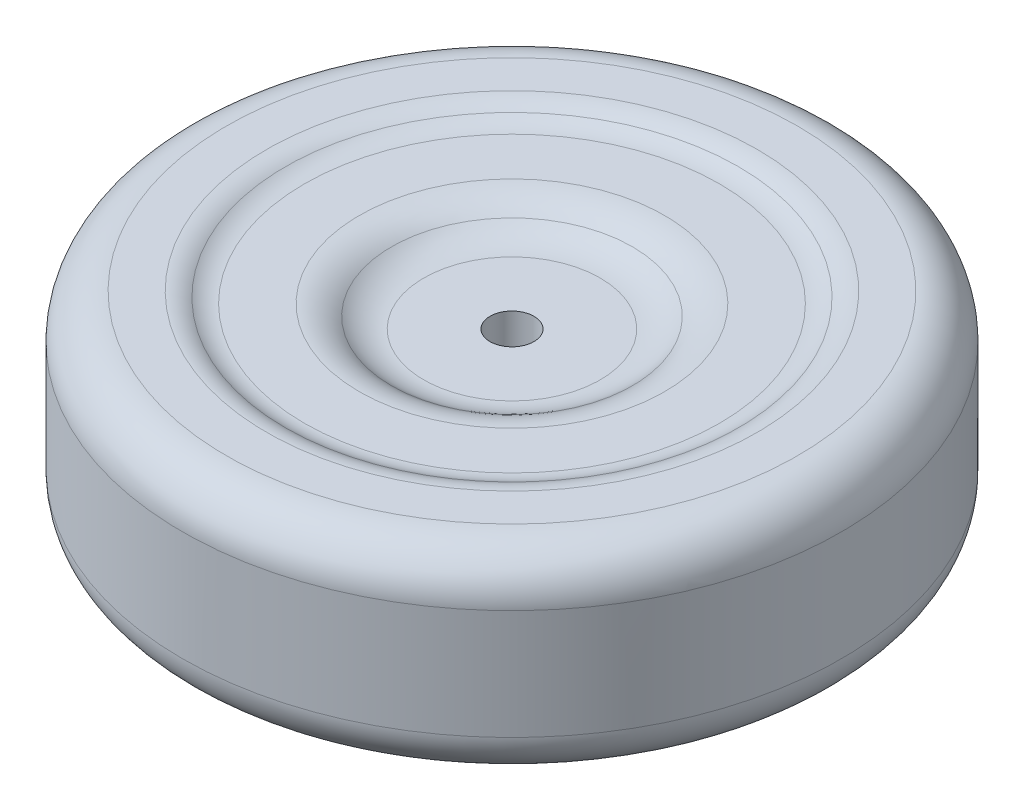
from build123d import *

# Parameters (mm, degrees)
SKETCH1_R            = 190.5
BOSS_EXTRUDE1_DEPTH  = 57.15
SKETCH2_R            = 19.05
CUT_EXTRUDE1_DEPTH   = 484.378
SKETCH3_R            = 127
CUT_EXTRUDE2_DEPTH   = 6.35
SKETCH4_R            = 63.5
CUT_EXTRUDE3_DEPTH   = 19.05
FILLET1_R            = 20.32
FILLET2_R            = 20.32
FILLET3_R            = 30.48
FILLET4_R            = 30.48
FILLET1_OF_MIRROR2_R = 20.32
FILLET2_OF_MIRROR2_R = 20.32
FILLET3_OF_MIRROR2_R = 30.48
FILLET4_OF_MIRROR2_R = 30.48
FILLET7_R            = 25.4
FILLET8_R            = 25.4
SKETCH5_R            = 51.013146757
BOSS_EXTRUDE3_DEPTH  = 76.2
SKETCH6_R            = 12.7
CUT_EXTRUDE4_DEPTH   = 1040.638


with BuildPart() as part:
    # Sketch1 → Boss-Extrude1 (new body)
    with BuildSketch(Plane(origin=(0, 0, 0), x_dir=(1, 0, 0), z_dir=(0, 1, 0))):
        with Locations(Location((0, 0, 0), (0, 0, 270))):
            Circle(SKETCH1_R)
    boss_extrude1 = extrude(amount=BOSS_EXTRUDE1_DEPTH)

    # Sketch2 → Cut-Extrude1 (cut)
    with BuildSketch(Plane(origin=(0, 57.15, 0), x_dir=(1, 0, 0), z_dir=(0, 1, 0))):
        with Locations(Location((0, 0, 0), (0, 0, 270))):
            Circle(SKETCH2_R)
    cut_extrude1 = extrude(amount=-CUT_EXTRUDE1_DEPTH, mode=Mode.SUBTRACT)

    # Sketch3 → Cut-Extrude2 (cut)
    with BuildSketch(Plane(origin=(0, 0, 0), x_dir=(-1, 0, 0), z_dir=(0, -1, 0))):
        with Locations(Location((0, 0, 0), (0, 0, 90))):
            Circle(SKETCH3_R)
    cut_extrude2 = extrude(amount=-CUT_EXTRUDE2_DEPTH, mode=Mode.SUBTRACT)

    # Sketch4 → Cut-Extrude3 (cut)
    with BuildSketch(Plane(origin=(0, 0, 0), x_dir=(1, 0, 0), z_dir=(0, 1, 0))):
        with Locations(Location((0, 0, 0), (0, 0, 90))):
            Circle(SKETCH4_R)
    cut_extrude3 = extrude(amount=CUT_EXTRUDE3_DEPTH, mode=Mode.SUBTRACT)

    # Fillet1
    # the kernel refuses this fillet: 20.32 mm, written as the material it takes off along each edge
    with BuildSketch(Plane(origin=(0, 0, 0), x_dir=(0, 0, -1), z_dir=(-1, 0, 0))) as fillet1_piece_1:
        with BuildLine():
            CenterArc((141.756066549, -20.32), FILLET1_R, 90, 46.567463442)
            Line((127, -6.35), (126.704878669, -6.0706))
            ThreePointArc((126.704878669, -6.0706), (126.5936, -3.175), (126.5936, 0))
            Line((126.5936, 0), (127, 0.4064))
            Line((127, 0.4064), (141.756066549, 0.4064))
            Line((141.756066549, 0.4064), (141.756066549, 0))
        make_face()
    revolve(axis=Axis((0, 0, 0), (0, -1, 0)), mode=Mode.SUBTRACT)

    # Fillet2
    fillet2_edges = [part.edges().sort_by_distance(p)[0] for p in [
        (0, 6.35, 127),
    ]]
    fillet(fillet2_edges, radius=FILLET2_R)

    # Fillet3
    # the kernel refuses this fillet: 30.48 mm, written as the material it takes off along each edge
    with BuildSketch(Plane(origin=(0, 6.35, 0), x_dir=(0, 0, -1), z_dir=(-1, 0, 0))) as fillet3_piece_1:
        with BuildLine():
            CenterArc((88.256857636, -30.48), FILLET3_R, 90, 54.314665287)
            Line((63.5, -12.7), (63.004862847, -12.3444))
            ThreePointArc((63.004862847, -12.3444), (62.8904, -6.35), (62.8904, 0))
            Line((62.8904, 0), (63.5, 0.6096))
            Line((63.5, 0.6096), (88.256857636, 0.6096))
            Line((88.256857636, 0.6096), (88.256857636, 0))
        make_face()
    revolve(axis=Axis((0, 6.35, 0), (0, -1, 0)), mode=Mode.SUBTRACT)

    # Fillet4
    fillet4_edges = [part.edges().sort_by_distance(p)[0] for p in [
        (0, 19.05, 63.5),
    ]]
    fillet(fillet4_edges, radius=FILLET4_R)

    # Mirror2: Boss-Extrude1, Cut-Extrude1, Cut-Extrude2, Cut-Extrude3 across plane
    add(boss_extrude1.mirror(Plane.ZX.offset(57.15)))
    add(cut_extrude1.mirror(Plane.ZX.offset(57.15)), mode=Mode.SUBTRACT)
    add(cut_extrude2.mirror(Plane.ZX.offset(57.15)), mode=Mode.SUBTRACT)
    add(cut_extrude3.mirror(Plane.ZX.offset(57.15)), mode=Mode.SUBTRACT)

    # Fillet1 of Mirror2
    # the kernel refuses this fillet: 20.32 mm, written as the material it takes off along each edge
    with BuildSketch(Plane(origin=(0, 114.3, 0), x_dir=(0, 0, -1), z_dir=(-1, 0, 0))) as fillet1_of_mirror2_piece_1:
        with BuildLine():
            CenterArc((141.756066549, 20.32), FILLET1_OF_MIRROR2_R, 223.432536558, 46.567463442)
            Line((127, 6.35), (126.704878669, 6.0706))
            ThreePointArc((126.704878669, 6.0706), (126.5936, 3.175), (126.5936, 0))
            Line((126.5936, 0), (127, -0.4064))
            Line((127, -0.4064), (141.756066549, -0.4064))
            Line((141.756066549, -0.4064), (141.756066549, 0))
        make_face()
    revolve(axis=Axis((0, 114.3, 0), (0, -1, 0)), mode=Mode.SUBTRACT)

    # Fillet2 of Mirror2
    fillet2_of_mirror2_edges = [part.edges().sort_by_distance(p)[0] for p in [
        (0, 107.95, 127),
    ]]
    fillet(fillet2_of_mirror2_edges, radius=FILLET2_OF_MIRROR2_R)

    # Fillet3 of Mirror2
    # the kernel refuses this fillet: 30.48 mm, written as the material it takes off along each edge
    with BuildSketch(Plane(origin=(0, 107.95, 0), x_dir=(0, 0, -1), z_dir=(1, 0, 0))) as fillet3_of_mirror2_piece_1:
        with BuildLine():
            CenterArc((88.256857636, -30.48), FILLET3_OF_MIRROR2_R, 90, 54.314665287)
            Line((63.5, -12.7), (63.004862847, -12.3444))
            ThreePointArc((63.004862847, -12.3444), (62.8904, -6.35), (62.8904, 0))
            Line((62.8904, 0), (63.5, 0.6096))
            Line((63.5, 0.6096), (88.256857636, 0.6096))
            Line((88.256857636, 0.6096), (88.256857636, 0))
        make_face()
    revolve(axis=Axis((0, 107.95, 0), (0, 1, 0)), mode=Mode.SUBTRACT)

    # Fillet4 of Mirror2
    fillet4_of_mirror2_edges = [part.edges().sort_by_distance(p)[0] for p in [
        (0, 95.25, 63.5),
    ]]
    fillet(fillet4_of_mirror2_edges, radius=FILLET4_OF_MIRROR2_R)

    # Fillet7
    fillet7_edges = [part.edges().sort_by_distance(p)[0] for p in [
        (0, 114.3, -190.5),
    ]]
    fillet(fillet7_edges, radius=FILLET7_R)

    # Fillet8
    fillet8_edges = [part.edges().sort_by_distance(p)[0] for p in [
        (0, 0, -190.5),
    ]]
    fillet(fillet8_edges, radius=FILLET8_R)

    # Sketch5 → Boss-Extrude3 (add)
    with BuildSketch(Plane(origin=(0, 95.25, 0), x_dir=(1, 0, 0), z_dir=(0, 1, 0))):
        Circle(SKETCH5_R)
    extrude(amount=-BOSS_EXTRUDE3_DEPTH)

    # Sketch6 → Cut-Extrude4 (cut)
    with BuildSketch(Plane(origin=(0, 95.25, 0), x_dir=(1, 0, 0), z_dir=(0, 1, 0))):
        with Locations(Location((0, 0, 0), (0, 0, 270))):
            Circle(SKETCH6_R)
    extrude(amount=-CUT_EXTRUDE4_DEPTH, mode=Mode.SUBTRACT)


solid = part.part
